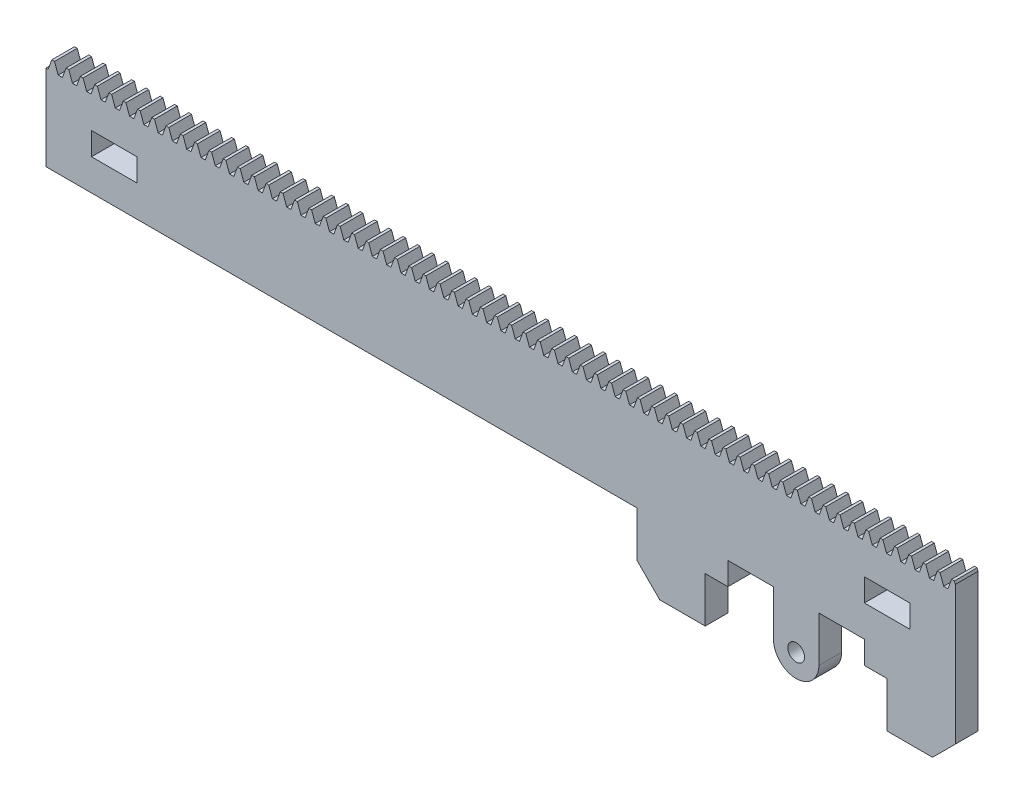
from build123d import *

# Parameters (mm, degrees)
BLANKSKE_W          = 254
BLANKSKE_H          = 26.67
BLANK_DEPTH         = 6.35
TOOTHCUTSIM_DEPTH   = 256.47526573
TEETHCUTS_COUNT     = 65
TEETHCUTS_PITCH     = 3.989822666
SKETCH3_W           = 12.7
SKETCH3_H           = 6.35
BOSS_EXTRUDE2_DEPTH = 6.35
SKETCH4_R           = 2.3495
BOSS_EXTRUDE3_DEPTH = 6.35
CHAMFER1_SIZE       = 6.35
SKETCH6_W           = 12.7
SKETCH6_H           = 6.35
CUT_EXTRUDE2_DEPTH  = 256.47526573
SKETCH8_W           = 12.7
SKETCH8_H           = 6.35
CUT_EXTRUDE3_DEPTH  = 256.47526573


with BuildPart() as part:
    # BlankSke → Blank (new body)
    with BuildSketch(Plane.XY):
        with Locations((127, 13.335)):
            Rectangle(BLANKSKE_W, BLANKSKE_H)
    extrude(amount=-BLANK_DEPTH)

    # TooCutSkeSim → ToothCutSim (cut, through all)
    with BuildSketch(Plane.XY):
        Polygon((0.595165029, 23.876), (-0.595165029, 23.876), (-1.621342708, 26.6954), (1.621342708, 26.6954), align=None)
    toothcutsim = extrude(amount=-TOOTHCUTSIM_DEPTH, mode=Mode.SUBTRACT)

    # TeethCuts: ToothCutSim ×65
    with Locations(*[(i * TEETHCUTS_PITCH, 0, 0) for i in range(1, TEETHCUTS_COUNT)]):
        add(toothcutsim, mode=Mode.SUBTRACT)

    # Sketch3 → Boss-Extrude2 (add)
    with BuildSketch(Plane.XY):
        Polygon((234.95, 0), (254, 0), (254, -19.05), (234.95, -19.05), (234.95, -6.35), (228.6, -6.35), (228.6, 0), align=None)
        with Locations((209.55, -3.175)):
            Rectangle(SKETCH3_W, SKETCH3_H)
        Polygon((190.5, -6.35), (190.5, 0), (184.15, 0), (165.1, 0), (165.1, -19.05), (184.15, -19.05), (184.15, -6.35), align=None)
    extrude(amount=-BOSS_EXTRUDE2_DEPTH)

    # Sketch4 → Boss-Extrude3 (add)
    with BuildSketch(Plane.XY):
        with BuildLine():
            Line((215.9, -12.7), (215.9, -6.35))
            Line((215.9, -6.35), (203.2, -6.35))
            Line((203.2, -6.35), (203.2, -12.7))
            ThreePointArc((203.2, -12.7), (209.55, -19.05), (215.9, -12.7))
        make_face()
        with Locations((209.55, -12.7)):
            Circle(SKETCH4_R, mode=Mode.SUBTRACT)
    extrude(amount=-BOSS_EXTRUDE3_DEPTH)

    # Chamfer1
    chamfer1_edges = [part.edges().sort_by_distance(p)[0] for p in [
        (254, -19.05, -3.175),
        (165.1, -19.05, -3.175),
    ]]
    chamfer(chamfer1_edges, length=CHAMFER1_SIZE)

    # Sketch6 → Cut-Extrude2 (cut, through all)
    with BuildSketch(Plane(origin=(0, 0, -6.35), x_dir=(-1, 0, 0), z_dir=(0, 0, -1))):
        with Locations((-19.05, 11.938)):
            Rectangle(SKETCH6_W, SKETCH6_H)
    extrude(amount=-CUT_EXTRUDE2_DEPTH, mode=Mode.SUBTRACT)

    # Sketch8 → Cut-Extrude3 (cut, through all)
    with BuildSketch(Plane(origin=(0, 0, -6.35), x_dir=(-1, 0, 0), z_dir=(0, 0, -1))):
        with Locations((-234.95, 11.938)):
            Rectangle(SKETCH8_W, SKETCH8_H)
    extrude(amount=-CUT_EXTRUDE3_DEPTH, mode=Mode.SUBTRACT)


solid = part.part
